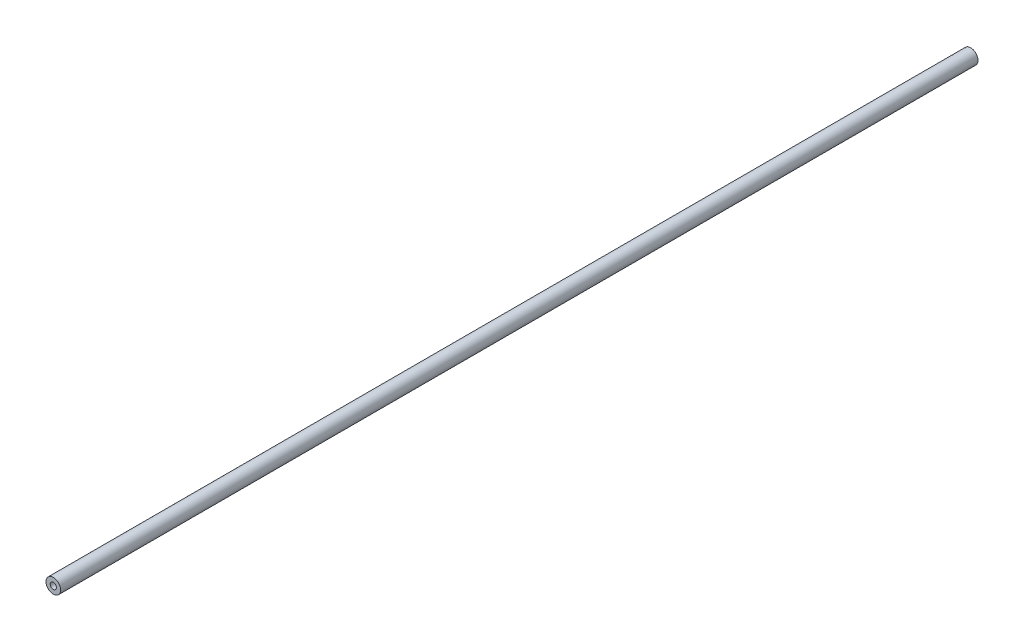
from build123d import *

# Parameters (mm, degrees)
SKETCH1_R                  = 4.7625
BOSS_EXTRUDE1_DEPTH        = 596.9
F_10_32_TAPPED_HOLE1_D     = 4.0386
F_10_32_TAPPED_HOLE1_DEPTH = 19.05
F_10_32_TAPPED_HOLE1_TIP   = 1.213317848
F_10_32_TAPPED_HOLE4_D     = 4.0386
F_10_32_TAPPED_HOLE4_DEPTH = 19.05
F_10_32_TAPPED_HOLE4_TIP   = 1.213317848


with BuildPart() as part:
    # Sketch1 → Boss-Extrude1 (new body)
    with BuildSketch(Plane.XY):
        Circle(SKETCH1_R)
    extrude(amount=-BOSS_EXTRUDE1_DEPTH)

    # #10-32 Tapped Hole1
    with Locations(Plane(origin=(0, 0, -596.9), x_dir=(-1, 0, 0), z_dir=(0, 0, -1))):
        with Locations((0, 0)):
            Hole(F_10_32_TAPPED_HOLE1_D / 2, depth=F_10_32_TAPPED_HOLE1_DEPTH)
            with Locations((0, 0, -(F_10_32_TAPPED_HOLE1_DEPTH + F_10_32_TAPPED_HOLE1_TIP / 2))):  # 118° drill point
                Cone(0, F_10_32_TAPPED_HOLE1_D / 2, F_10_32_TAPPED_HOLE1_TIP, mode=Mode.SUBTRACT)

    # #10-32 Tapped Hole4
    with Locations(Plane.XY):
        with Locations((0, 0)):
            Hole(F_10_32_TAPPED_HOLE4_D / 2, depth=F_10_32_TAPPED_HOLE4_DEPTH)
            with Locations((0, 0, -(F_10_32_TAPPED_HOLE4_DEPTH + F_10_32_TAPPED_HOLE4_TIP / 2))):  # 118° drill point
                Cone(0, F_10_32_TAPPED_HOLE4_D / 2, F_10_32_TAPPED_HOLE4_TIP, mode=Mode.SUBTRACT)


solid = part.part
